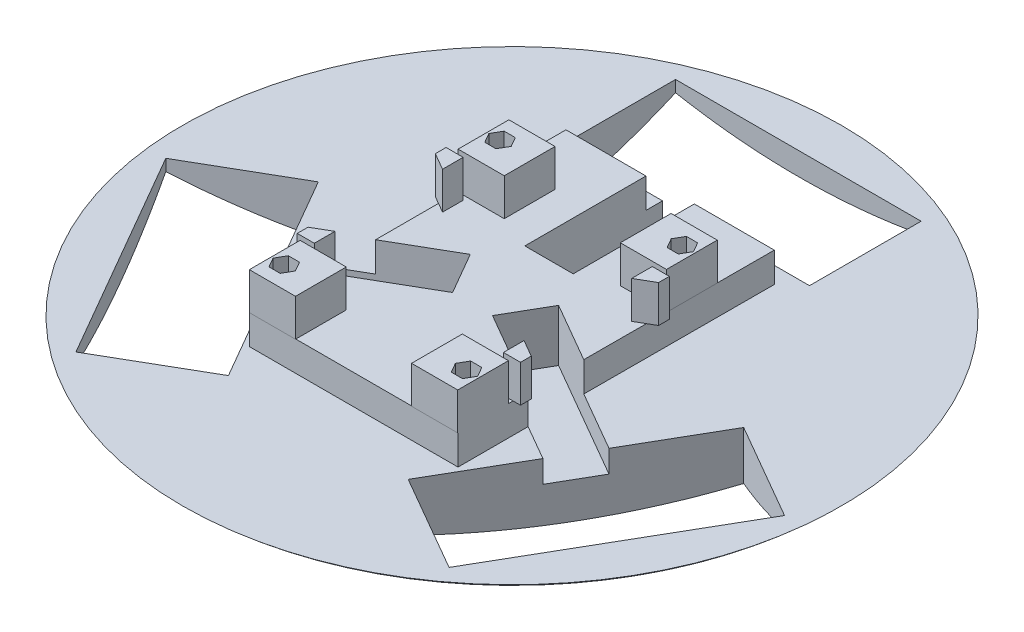
from build123d import *

# Parameters (mm, degrees)
SKETCH2_W           = 66
SKETCH2_H           = 30
CUT_EXTRUDE1_DEPTH  = 40
SKETCH4_W           = 13
SKETCH4_H           = 37
CUT_EXTRUDE2_DEPTH  = 6
BOSS_EXTRUDE1_DEPTH = 8
SKETCH6_W           = 12.402318472
SKETCH6_H           = 13.641488334
SKETCH6_H_2         = 13.641488333
BOSS_EXTRUDE2_DEPTH = 10
BOSS_EXTRUDE3_DEPTH = 10


with BuildPart() as part:
    # Sketch3 → Revolve1 (revolve)
    with BuildSketch(Plane(origin=(0, 0, 0), x_dir=(0, 0, -1), z_dir=(1, 0, 0))):
        with BuildLine():
            Line((0, 20), (0, 0))
            ThreePointArc((0, 0), (43.440585665, 3.508757487), (84.753971762, 17.38679738))
            ThreePointArc((84.753971762, 17.38679738), (86.762776598, 18.545504508), (88.56897203, 20))
            Line((88.56897203, 20), (0, 20))
        make_face()
    revolve(axis=Axis((0, 20, 0), (0, -1, 0)))

    # Sketch2 → Cut-Extrude1 (cut)
    with BuildSketch(Plane(origin=(0, 0, 0), x_dir=(1, 0, 0), z_dir=(0, 1, 0))):
        with Locations((0, 61.949465814)):
            Rectangle(SKETCH2_W, SKETCH2_H)
        Polygon((83.140192202, -9.895894582), (50.140192202, -67.053571232), (24.159430089, -52.053571232), (57.159430089, 5.104105418), align=None)
        Polygon((-50.140192202, -67.053571232), (-83.140192202, -9.895894582), (-57.159430089, 5.104105418), (-24.159430089, -52.053571232), align=None)
    extrude(amount=CUT_EXTRUDE1_DEPTH, mode=Mode.SUBTRACT)

    # Sketch4 → Cut-Extrude2 (cut)
    with BuildSketch(Plane(origin=(0, 20, 0), x_dir=(1, 0, 0), z_dir=(0, 1, 0))):
        with Locations((0, 28.449465814)):
            Rectangle(SKETCH4_W, SKETCH4_H)
        Polygon((37.409430089, -29.103898031), (43.909430089, -17.845567782), (11.866490149, 0.654432218), (5.366490149, -10.603898031), align=None)
        Polygon((-43.909430089, -17.845567782), (-37.409430089, -29.103898031), (-5.366490149, -10.603898031), (-11.866490149, 0.654432218), align=None)
    extrude(amount=-CUT_EXTRUDE2_DEPTH, mode=Mode.SUBTRACT)

    # Sketch5 → Boss-Extrude1 (add)
    with BuildSketch(Plane(origin=(0, 20, 0), x_dir=(1, 0, 0), z_dir=(0, 1, 0))):
        Polygon((-28, 42.5), (-6.5, 42.5), (-6.5, 9.949465814), (6.5, 9.949465814), (6.5, 42.5), (28, 42.5), (27.887960119, -8.595567782), (11.866490149, 0.654432218), (5.366490149, -10.603898031), (28, -23.671361037), (28, -42.5), (-28, -42.5), (-28, -23.671361037), (-5.366490149, -10.603898031), (-11.866490149, 0.654432218), (-28, -8.660254038), align=None)
    extrude(amount=BOSS_EXTRUDE1_DEPTH)

    # Sketch6 → Boss-Extrude2 (add)
    # profile 1 of 4: a face of its own
    with BuildSketch(Plane(origin=(0, 28, 0), x_dir=(1, 0, 0), z_dir=(0, 1, 0))):
        with Locations((-21.798840764, 20.339745962)):
            Rectangle(SKETCH6_W, SKETCH6_H)
        Polygon((-21.4977786, 21.28552155), (-22.9988893, 23.88552155), (-26.0011107, 23.88552155), (-27.5022214, 21.28552155), (-26.0011107, 18.68552155), (-22.9988893, 18.68552155), align=None, mode=Mode.SUBTRACT)
    # profile 2 of 4: a face of its own
    with BuildSketch(Plane(origin=(0, 28, 0), x_dir=(1, 0, 0), z_dir=(0, 1, 0))):
        with Locations((21.798840764, 20.339745962)):
            Rectangle(SKETCH6_W, SKETCH6_H)
        Polygon((21.4977786, 21.28552155), (22.9988893, 23.88552155), (26.0011107, 23.88552155), (27.5022214, 21.28552155), (26.0011107, 18.68552155), (22.9988893, 18.68552155), align=None, mode=Mode.SUBTRACT)
    # profile 3 of 4: a face of its own
    with BuildSketch(Plane(origin=(0, 28, 0), x_dir=(1, 0, 0), z_dir=(0, 1, 0))):
        with Locations((21.798840764, -35.768702862)):
            Rectangle(SKETCH6_W, SKETCH6_H_2)
        Polygon((26.0011107, -39.31447845), (27.5022214, -36.71447845), (26.0011107, -34.11447845), (22.9988893, -34.11447845), (21.4977786, -36.71447845), (22.9988893, -39.31447845), align=None, mode=Mode.SUBTRACT)
    # profile 4 of 4: a face of its own
    with BuildSketch(Plane(origin=(0, 28, 0), x_dir=(1, 0, 0), z_dir=(0, 1, 0))):
        with Locations((-21.798840764, -35.768702862)):
            Rectangle(SKETCH6_W, SKETCH6_H_2)
        Polygon((-21.4977786, -36.71447845), (-22.9988893, -39.31447845), (-26.0011107, -39.31447845), (-27.5022214, -36.71447845), (-26.0011107, -34.11447845), (-22.9988893, -34.11447845), align=None, mode=Mode.SUBTRACT)
    extrude(amount=BOSS_EXTRUDE2_DEPTH)

    # Sketch8 → Boss-Extrude3 (add)
    with BuildSketch(Plane(origin=(0, 28, 0), x_dir=(1, 0, 0), z_dir=(0, 1, 0))):
        Polygon((-25.413351143, -22.177958623), (-30, -24.826061575), (-30, -27.71447845), (-25.413351143, -27.71447845), align=None)
        Polygon((25.413351143, -27.71447845), (30, -27.71447845), (30, -24.826061575), (25.413351143, -22.177958623), align=None)
        Polygon((-30, 12.28552155), (-30, 9.397104676), (-25.413351143, 6.749001724), (-25.413351143, 12.28552155), align=None)
        Polygon((30, 9.397104676), (30, 12.28552155), (25.413351143, 12.28552155), (25.413351143, 6.749001724), align=None)
    extrude(amount=BOSS_EXTRUDE3_DEPTH)


solid = part.part
